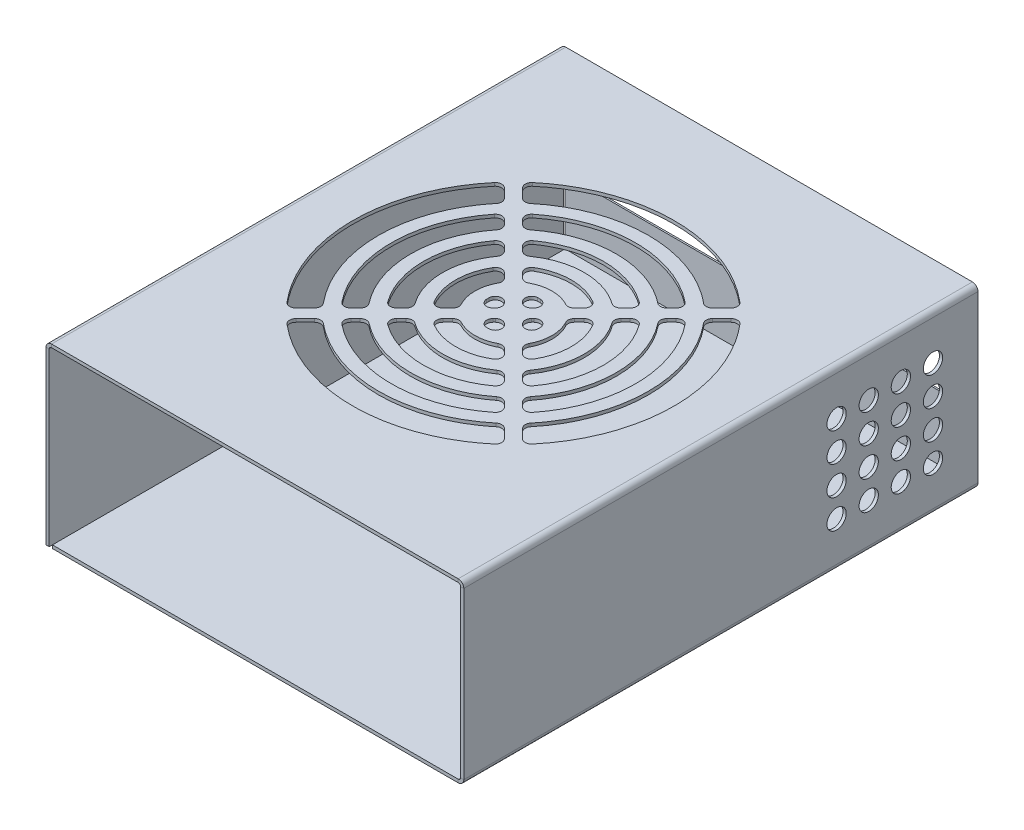
from build123d import *

# Parameters (mm, degrees)
BASE_FLANGE2_DEPTH  = 160
VENT1_START         = 54
VENT1_DEPTH         = 1
SKETCH25_W          = 126.2634
SKETCH25_H          = 0.5
BOSS_EXTRUDE3_DEPTH = 20
SKETCH27_W          = 126.5268
SKETCH27_H          = 2
BOSS_EXTRUDE4_DEPTH = 20
SKETCH28_R          = 3
CUT_EXTRUDE1_DEPTH  = 10


# Read off the part's stored shape, not the designer's step: Vent1
# Sheet-metal steps are written as plain solids
with BuildPart() as part:
    # Sketch1 → Base-Flange2 (new body)
    with BuildSketch(Plane.XY):
        with BuildLine():
            Line((0, 0), (0, 53.2634))
            ThreePointArc((0, 53.2634), (0.508638364, 54.491361636), (1.7366, 55))
            Line((1.7366, 55), (128.2634, 55))
            ThreePointArc((128.2634, 55), (129.491361636, 54.491361636), (130, 53.2634))
            Line((130, 53.2634), (130, 1.7366))
            ThreePointArc((130, 1.7366), (129.491361636, 0.508638364), (128.2634, 0))
            Line((128.2634, 0), (2, 0))
            Line((2, 0), (2, 1))
            Line((2, 1), (128.2634, 1))
            ThreePointArc((128.2634, 1), (128.784254855, 1.215745145), (129, 1.7366))
            Line((129, 1.7366), (129, 53.2634))
            ThreePointArc((129, 53.2634), (128.784254855, 53.784254855), (128.2634, 54))
            Line((128.2634, 54), (1.7366, 54))
            ThreePointArc((1.7366, 54), (1.215745145, 53.784254855), (1, 53.2634))
            Line((1, 53.2634), (1, 0))
            Line((1, 0), (0, 0))
        make_face()
    extrude(amount=BASE_FLANGE2_DEPTH)

    # Vent1 outline → Vent1 (cut)
    with BuildSketch(Plane(origin=(0, 0, 0), x_dir=(1, 0, 0), z_dir=(0, 1, 0)).offset(VENT1_START)):
        with BuildLine():
            ThreePointArc((30.082139275, -47.449789294), (28.584622626, -46.865738461), (27.14091293, -47.572402315))
            add(Edge.make_bspline(
                [(27.14091293, -47.572402315), (26.982214266, -47.760026027), (25.777430122, -49.205996623), (23.680073283, -52.036028488), (21.151872309, -56.250671963), (19.052170644, -60.694148895), (17.394784493, -65.321036718), (16.202307354, -70.088764961), (15.479428448, -74.95008843), (15.240002061, -79.858846861), (15.479410231, -84.76778804), (16.202235618, -89.628935826), (17.394730542, -94.39684686), (19.052029931, -99.023572814), (21.15178469, -103.467225566), (23.679869024, -107.68172717), (25.777318904, -110.511917442), (26.98209546, -111.957894833), (27.140913183, -112.145659251)],
                knots=[0.388277454, 0.388277454, 0.388277454, 0.388277454, 0.390624117, 0.406249996, 0.421874117, 0.437499996, 0.453124117, 0.468749996, 0.484374117, 0.499999996, 0.515624117, 0.531249996, 0.546874117, 0.562499996, 0.578124117, 0.593749996, 0.609374117, 0.61172254, 0.61172254, 0.61172254, 0.61172254], degree=3))
            ThreePointArc((27.140913183, -112.145659251), (28.584622839, -112.852322899), (30.082139349, -112.26827206))
            Line((30.082139349, -112.26827206), (32.921385852, -109.429025558))
            ThreePointArc((32.921385852, -109.429025558), (33.505103142, -108.105764237), (33.044029266, -106.734940661))
            add(Edge.make_bspline(
                [(33.044029345, -52.983120633), (32.980126693, -53.059854323), (32.040691116, -54.196190961), (30.342437867, -56.487698284), (28.218745017, -60.028003701), (26.454997453, -63.760518251), (25.06279009, -67.647109614), (24.061109906, -71.651995023), (23.453889777, -75.735512806), (23.252770982, -79.858863575), (23.453873217, -83.982380479), (24.061044692, -88.065738549), (25.062741044, -92.070790132), (26.45486953, -95.957234344), (28.218665371, -99.68990872), (30.342252152, -103.230085202), (32.040590542, -105.521735994), (32.980019469, -106.658078322), (33.044029266, -106.734940661)],
                knots=[0.389488825, 0.389488825, 0.389488825, 0.389488825, 0.390624044, 0.406249995, 0.421874044, 0.437499995, 0.453124044, 0.468749995, 0.484374044, 0.499999995, 0.515624044, 0.531249995, 0.546874044, 0.562499995, 0.578124044, 0.593749995, 0.609374044, 0.610511167, 0.610511167, 0.610511167, 0.610511167], degree=3))
            ThreePointArc((33.044029345, -52.983120633), (33.50510312, -51.612297097), (32.921385833, -50.289035852))
            Line((32.921385833, -50.289035852), (30.082139275, -47.449789294))
        make_face()
        with BuildLine():
            ThreePointArc((97.729049259, -44.621362151), (98.313100091, -43.123845478), (97.606436201, -41.680135774))
            add(Edge.make_bspline(
                [(97.606436201, -41.680135774), (97.418812497, -41.521437124), (95.972841881, -40.31665305), (93.142806383, -38.219294172), (88.928163855, -35.691091323), (84.484677899, -33.591389071), (79.857793802, -31.934004798), (75.090057161, -30.741527024), (70.228741703, -30.018650504), (65.319974957, -29.779224955), (60.411042092, -30.018633962), (55.549886297, -30.741461737), (50.78198366, -31.933956025), (46.155253979, -33.591257291), (41.711610261, -35.69101147), (37.497107673, -38.219093898), (34.666921169, -40.316541796), (33.220943742, -41.521318312), (33.03317934, -41.680136006)],
                knots=[0.138277454, 0.138277454, 0.138277454, 0.138277454, 0.140624117, 0.156249996, 0.171874157, 0.187499996, 0.203124197, 0.218749996, 0.234374197, 0.249999996, 0.265624197, 0.281249996, 0.296874197, 0.312499996, 0.328124157, 0.343749996, 0.359374117, 0.361722539, 0.361722539, 0.361722539, 0.361722539], degree=3))
            ThreePointArc((33.03317934, -41.680136006), (32.326515624, -43.123845675), (32.910566462, -44.621362231))
            Line((32.910566462, -44.621362231), (35.749812977, -47.460608746))
            ThreePointArc((35.749812977, -47.460608746), (37.073074297, -48.044326036), (38.443897874, -47.583252161))
            add(Edge.make_bspline(
                [(92.195717914, -47.583252246), (92.118990654, -47.519354951), (90.982654296, -46.579919046), (88.691154135, -44.881670086), (85.150842331, -42.757971749), (81.418331743, -40.994225489), (77.531733583, -39.602012163), (73.526847518, -38.60033397), (69.44332577, -37.993112524), (65.319974948, -37.791993916), (61.196458059, -37.9930961), (57.113099984, -38.600267589), (53.108048402, -39.601963937), (49.22160419, -40.994092425), (45.488929814, -42.757888265), (41.948753333, -44.881475046), (39.65710254, -46.579813436), (38.520760212, -47.519242363), (38.443897874, -47.583252161)],
                knots=[0.139488825, 0.139488825, 0.139488825, 0.139488825, 0.140623949, 0.156249995, 0.171873949, 0.187499995, 0.203123996, 0.218749995, 0.234374044, 0.249999995, 0.265624044, 0.281249995, 0.296874044, 0.312499995, 0.328124044, 0.343749995, 0.359374044, 0.360511167, 0.360511167, 0.360511167, 0.360511167], degree=3))
            ThreePointArc((92.195717914, -47.583252246), (93.566541446, -48.044326012), (94.889802684, -47.460608726))
            Line((94.889802684, -47.460608726), (97.729049259, -44.621362151))
        make_face()
        with BuildLine():
            ThreePointArc((32.910565565, -115.096700094), (32.326514725, -116.594216583), (33.033178341, -118.037926232))
            add(Edge.make_bspline(
                [(33.033178341, -118.037926232), (33.220805336, -118.196627724), (34.666776082, -119.401411914), (37.496816239, -121.498771922), (41.711456423, -124.026970329), (46.154941469, -126.126674253), (50.781821901, -127.784056503), (55.549558462, -128.976534439), (60.410873942, -129.699410916), (65.319640681, -129.938836473), (70.228573553, -129.699427476), (75.089729324, -128.976599655), (79.85763205, -127.78410554), (84.484365364, -126.126802209), (88.928010114, -124.027049855), (93.142518204, -121.498960251), (95.972701137, -119.401514543), (97.418678277, -118.196737754), (97.606436275, -118.037925486)],
                knots=[0.638277453, 0.638277453, 0.638277453, 0.638277453, 0.640624157, 0.656249996, 0.671874197, 0.687499996, 0.703124197, 0.718749996, 0.734374197, 0.749999996, 0.765624197, 0.781249996, 0.796874197, 0.812499996, 0.828124197, 0.843749996, 0.859374197, 0.861722539, 0.861722539, 0.861722539, 0.861722539], degree=3))
            ThreePointArc((97.606436275, -118.037925486), (98.313100037, -116.594215807), (97.729049201, -115.09669922))
            Line((97.729049201, -115.09669922), (94.889802663, -112.257452682))
            ThreePointArc((94.889802663, -112.257452682), (93.566541342, -111.673735393), (92.195717766, -112.134809268))
            add(Edge.make_bspline(
                [(38.443897739, -112.13480919), (38.520631429, -112.198711841), (39.656968067, -113.138147418), (41.94847539, -114.836400667), (45.488780807, -116.960093517), (49.221295357, -118.723841081), (53.107886719, -120.116048444), (57.112772129, -121.117728628), (61.196289912, -121.724948757), (65.319640681, -121.926067552), (69.443157584, -121.724965318), (73.526515655, -121.117793843), (77.531567238, -120.11609749), (81.41801145, -118.723969004), (85.150685826, -116.960173163), (88.690862307, -114.836586383), (90.9825131, -113.138247993), (92.118855428, -112.198819065), (92.195717766, -112.134809268)],
                knots=[0.639488825, 0.639488825, 0.639488825, 0.639488825, 0.640624044, 0.656249995, 0.671874044, 0.687499995, 0.703124044, 0.718749995, 0.734374044, 0.749999995, 0.765624044, 0.781249995, 0.796874044, 0.812499995, 0.828124044, 0.843749995, 0.859374044, 0.860511167, 0.860511167, 0.860511167, 0.860511167], degree=3))
            ThreePointArc((38.443897739, -112.13480919), (37.073074203, -111.673735415), (35.749812958, -112.257452701))
            Line((35.749812958, -112.257452701), (32.910565565, -115.096700094))
        make_face()
        with BuildLine():
            ThreePointArc((100.557476362, -112.268272131), (102.054993004, -112.852322965), (103.498702699, -112.145659121))
            add(Edge.make_bspline(
                [(103.498702699, -112.145659121), (103.657406774, -111.958029013), (104.862190572, -110.51205811), (106.959551614, -107.682019037), (109.487747415, -103.467382029), (111.587451016, -99.02389704), (113.244835002, -94.397016815), (114.437316529, -89.629238538), (115.160211781, -84.767924785), (115.319814733, -81.495355993), (115.31980782, -79.859030714), (115.319800908, -78.222793716), (115.160178958, -74.95022958), (114.437374627, -70.089079925), (113.244883533, -65.321214774), (111.58758613, -60.694488557), (109.487830831, -56.250835885), (106.959746671, -52.036334226), (104.862296706, -49.206144092), (103.657520257, -47.760166646), (103.498702575, -47.572402251)],
                knots=[0.888277454, 0.888277454, 0.888277454, 0.888277454, 0.890624197, 0.906249996, 0.921874197, 0.937499996, 0.953124197, 0.968749996, 0.984374599, 1, 1, 1, 1.015624558, 1.031249996, 1.046874117, 1.062499996, 1.078124117, 1.093749996, 1.109374117, 1.111722539, 1.111722539, 1.111722539, 1.111722539], degree=3))
            ThreePointArc((103.498702575, -47.572402251), (102.054992899, -46.865738502), (100.557476321, -47.449789338))
            Line((100.557476321, -47.449789338), (97.718229786, -50.289035873))
            ThreePointArc((97.718229786, -50.289035873), (97.134512496, -51.612297199), (97.59558638, -52.983120779))
            add(Edge.make_bspline(
                [(97.595586294, -106.734940799), (97.659488946, -106.658207108), (98.59892452, -105.521870468), (100.297177746, -103.230363141), (102.420870723, -99.690057741), (104.184617811, -95.957543127), (105.576826952, -92.070952004), (106.578510716, -88.066024868), (107.185749624, -83.982508816), (107.319814733, -81.233550669), (107.31980782, -79.859030714), (107.319800908, -78.48459904), (107.185716801, -75.735645549), (106.578568815, -71.652293594), (105.576875483, -67.647279586), (104.184752925, -63.760842471), (102.420954138, -60.028160174), (100.297372804, -56.48799012), (98.599030132, -54.196332159), (97.659601534, -53.059989549), (97.59558638, -52.983120779)],
                knots=[0.889488825, 0.889488825, 0.889488825, 0.889488825, 0.890624044, 0.906249995, 0.921874044, 0.937499995, 0.953124044, 0.968749995, 0.984374522, 1, 1, 1, 1.015624474, 1.031249995, 1.046873949, 1.062499995, 1.078123949, 1.093749995, 1.109373949, 1.110511166, 1.110511166, 1.110511166, 1.110511166], degree=3))
            ThreePointArc((97.595586294, -106.734940799), (97.134512521, -108.105764334), (97.718229807, -109.429025577))
            Line((97.718229807, -109.429025577), (100.557476362, -112.268272131))
        make_face()
        with BuildLine():
            ThreePointArc((41.435501176, -106.571764483), (40.852818334, -108.097354655), (41.601538547, -109.548686013))
            add(Edge.make_bspline(
                [(41.601538547, -109.548686013), (42.442832812, -110.220649998), (44.317606842, -111.591175423), (47.377442856, -113.426655291), (50.754472339, -115.022424446), (54.270919119, -116.282044428), (57.894378965, -117.188325719), (61.588997896, -117.737717678), (65.319640681, -117.919683092), (69.0504496, -117.737734238), (72.744908821, -117.188390936), (76.368534832, -116.282093465), (79.884834493, -115.022552402), (83.262023682, -113.426734817), (86.321874421, -111.591274358), (88.196782443, -110.220649195), (89.038076682, -109.548684875)],
                knots=[0.642721101, 0.642721101, 0.642721101, 0.642721101, 0.656249995, 0.671873944, 0.687499995, 0.703123944, 0.718749995, 0.734373944, 0.749999995, 0.765623944, 0.781249995, 0.796873944, 0.812499995, 0.828123944, 0.843749995, 0.857278892, 0.857278892, 0.857278892, 0.857278892], degree=3))
            ThreePointArc((89.038076682, -109.548684875), (89.786796505, -108.097353582), (89.204113649, -106.571763668))
            Line((89.204113649, -106.571763668), (87.780185051, -105.14783507))
            ThreePointArc((87.780185051, -105.14783507), (86.483794791, -104.565522232), (85.12791213, -104.991313447))
            add(Edge.make_bspline(
                [(45.511703469, -104.991313414), (46.168710622, -105.509168886), (48.541629868, -107.233376712), (52.994998734, -109.613751963), (59.036674635, -111.446474311), (65.31980782, -112.065308916), (71.602941005, -111.446474311), (77.644616906, -109.613751963), (82.097985772, -107.233376712), (84.470905018, -105.509168886), (85.12791213, -104.991313447)],
                knots=[0.643767906, 0.643767906, 0.643767906, 0.643767906, 0.65625, 0.6875, 0.71875, 0.75, 0.78125, 0.8125, 0.84375, 0.856232094, 0.856232094, 0.856232094, 0.856232094], degree=3))
            ThreePointArc((45.511703469, -104.991313414), (44.155820852, -104.565522232), (42.859430589, -105.14783507))
            Line((42.859430589, -105.14783507), (41.435501176, -106.571764483))
        make_face()
        with BuildLine():
            ThreePointArc((38.6070749, -55.974724919), (37.081484906, -55.392042067), (35.630153592, -56.140762011))
            add(Edge.make_bspline(
                [(35.630153592, -56.140762011), (34.958189407, -56.982056221), (33.587667651, -58.856822604), (31.752187347, -61.916658395), (30.156420451, -65.293679766), (28.896796568, -68.810133936), (27.990516073, -72.433585465), (27.441121686, -76.128212383), (27.259155442, -79.858846861), (27.441103469, -83.589664087), (27.990444337, -87.284115322), (28.896742617, -90.907749643), (30.156279738, -94.424041944), (31.752099729, -97.801239133), (33.587559288, -100.861090571), (34.958189322, -102.736005442), (35.630153696, -103.577299669)],
                knots=[0.392721099, 0.392721099, 0.392721099, 0.392721099, 0.406249994, 0.421873838, 0.437499994, 0.453123838, 0.468749994, 0.484373838, 0.499999994, 0.515623838, 0.531249994, 0.546873838, 0.562499994, 0.578123838, 0.593749994, 0.607278892, 0.607278892, 0.607278892, 0.607278892], degree=3))
            ThreePointArc((35.630153696, -103.577299669), (37.081484978, -104.326019423), (38.607074846, -103.743336564))
            Line((38.607074846, -103.743336564), (40.031003464, -102.319407946))
            ThreePointArc((40.031003464, -102.319407946), (40.613316303, -101.023017685), (40.187525087, -99.667135024))
            add(Edge.make_bspline(
                [(40.18752512, -60.050926363), (39.669669648, -60.707933516), (37.945461823, -63.080852762), (35.565086571, -67.534221628), (33.732364223, -73.575897529), (33.113529618, -79.859030714), (33.732364223, -86.1421639), (35.565086571, -92.1838398), (37.945461823, -96.637208666), (39.669669648, -99.010127912), (40.187525087, -99.667135024)],
                knots=[0.393767906, 0.393767906, 0.393767906, 0.393767906, 0.40625, 0.4375, 0.46875, 0.5, 0.53125, 0.5625, 0.59375, 0.606232094, 0.606232094, 0.606232094, 0.606232094], degree=3))
            ThreePointArc((40.18752512, -60.050926363), (40.613316303, -58.695043746), (40.031003464, -57.398653483))
            Line((40.031003464, -57.398653483), (38.6070749, -55.974724919))
        make_face()
        with BuildLine():
            ThreePointArc((89.204113615, -53.146297795), (89.786796467, -51.6207078), (89.038076523, -50.169376486))
            add(Edge.make_bspline(
                [(89.038076523, -50.169376486), (88.196782313, -49.497412301), (86.32201593, -48.126890545), (83.262180139, -46.291410241), (79.885158769, -44.695643346), (76.368704599, -43.436019462), (72.745253069, -42.529738967), (69.050626151, -41.98034458), (65.319991673, -41.798378336), (61.589174448, -41.980326363), (57.894723212, -42.529667231), (54.271088892, -43.435965512), (50.754796588, -44.69550263), (47.377599409, -46.29132263), (44.317747958, -48.126782142), (42.442833191, -49.497412231), (41.60153895, -50.169376557)],
                knots=[0.142721099, 0.142721099, 0.142721099, 0.142721099, 0.156249994, 0.171873838, 0.187499994, 0.203123838, 0.218749994, 0.234373838, 0.249999994, 0.265623838, 0.281249994, 0.296873838, 0.312499994, 0.328123838, 0.343749994, 0.357278892, 0.357278892, 0.357278892, 0.357278892], degree=3))
            ThreePointArc((41.60153895, -50.169376557), (40.852819133, -51.620707849), (41.43550199, -53.14629776))
            Line((41.43550199, -53.14629776), (42.859430589, -54.570226358))
            ThreePointArc((42.859430589, -54.570226358), (44.155820849, -55.152539197), (45.51170351, -54.726747981))
            add(Edge.make_bspline(
                [(85.127912172, -54.726748014), (84.470905018, -54.208892542), (82.097985772, -52.484684717), (77.644616906, -50.104309465), (71.602941005, -48.271587118), (65.31980782, -47.652752513), (59.036674635, -48.271587118), (52.994998734, -50.104309465), (48.541629868, -52.484684717), (46.168710622, -54.208892542), (45.51170351, -54.726747981)],
                knots=[0.143767906, 0.143767906, 0.143767906, 0.143767906, 0.15625, 0.1875, 0.21875, 0.25, 0.28125, 0.3125, 0.34375, 0.356232094, 0.356232094, 0.356232094, 0.356232094], degree=3))
            ThreePointArc((85.127912172, -54.726748014), (86.483794788, -55.152539197), (87.780185051, -54.570226358))
            Line((87.780185051, -54.570226358), (89.204113615, -53.146297795))
        make_face()
        with BuildLine():
            ThreePointArc((92.03254074, -103.74333651), (93.558130735, -104.326019362), (95.009462049, -103.577299418))
            add(Edge.make_bspline(
                [(95.009462049, -103.577299418), (95.681426234, -102.736005208), (97.051952896, -100.86123208), (98.887432377, -97.801395597), (100.483201209, -94.42436617), (101.742822927, -90.907919598), (102.649107809, -87.284418034), (103.198518545, -83.589800831), (103.319814733, -81.102648007), (103.31980782, -79.859030714), (103.319800908, -78.615501702), (103.198485722, -76.128353534), (102.649165908, -72.433900429), (101.742871458, -68.810311992), (100.483336323, -65.294019427), (98.887515792, -61.916822318), (97.052056414, -58.856970846), (95.681426307, -56.982056079), (95.009461973, -56.140761836)],
                knots=[0.8927211, 0.8927211, 0.8927211, 0.8927211, 0.906249995, 0.921873944, 0.937499995, 0.953123944, 0.968749995, 0.984374472, 1, 1, 1, 1.015624419, 1.031249994, 1.046873838, 1.062499994, 1.078123838, 1.093749994, 1.107278892, 1.107278892, 1.107278892, 1.107278892], degree=3))
            ThreePointArc((95.009461973, -56.140761836), (93.558130682, -55.392042026), (92.032540776, -55.974724883))
            Line((92.032540776, -55.974724883), (90.608612176, -57.398653483))
            ThreePointArc((90.608612176, -57.398653483), (90.026299338, -58.695043744), (90.452090553, -60.050926405))
            add(Edge.make_bspline(
                [(90.45209052, -99.667135066), (90.969945992, -99.010127912), (92.694153818, -96.637208666), (95.074529069, -92.1838398), (96.907251417, -86.1421639), (97.31980782, -81.953408443), (97.31980782, -79.859030714), (97.31980782, -77.764652986), (96.907251417, -73.575897529), (95.074529069, -67.534221628), (92.694153818, -63.080852762), (90.969945992, -60.707933516), (90.452090553, -60.050926405)],
                knots=[0.893767906, 0.893767906, 0.893767906, 0.893767906, 0.90625, 0.9375, 0.96875, 1, 1, 1, 1.03125, 1.0625, 1.09375, 1.106232094, 1.106232094, 1.106232094, 1.106232094], degree=3))
            ThreePointArc((90.45209052, -99.667135066), (90.026299337, -101.023017682), (90.608612176, -102.319407946))
            Line((90.608612176, -102.319407946), (92.03254074, -103.74333651))
        make_face()
        with BuildLine():
            ThreePointArc((48.568154514, -99.439111145), (47.988324487, -101.007565299), (48.802456202, -102.468195589))
            add(Edge.make_bspline(
                [(48.802456202, -102.468195589), (49.118175611, -102.69887724), (50.94106508, -103.973092933), (54.53559987, -105.894411807), (59.822066283, -107.498043861), (65.31980782, -108.039524141), (70.817549357, -107.498043861), (76.10401577, -105.894411807), (79.69855056, -103.973092933), (81.521440029, -102.69887724), (81.837159439, -102.468195589)],
                knots=[0.649582268, 0.649582268, 0.649582268, 0.649582268, 0.65625, 0.6875, 0.71875, 0.75, 0.78125, 0.8125, 0.84375, 0.850417732, 0.850417732, 0.850417732, 0.850417732], degree=3))
            ThreePointArc((81.837159439, -102.468195589), (82.651291154, -101.007565299), (82.071461126, -99.439111145))
            Line((82.071461126, -99.439111145), (80.63877927, -98.006429289))
            ThreePointArc((80.63877927, -98.006429289), (79.39176688, -97.427644164), (78.065750594, -97.790566923))
            add(Edge.make_bspline(
                [(52.573865028, -97.79056691), (52.746578754, -97.913348473), (54.106692458, -98.85094309), (56.846501573, -100.315401573), (61.000153755, -101.575398187), (65.31980782, -102.000846978), (69.639461885, -101.575398187), (73.793114067, -100.315401573), (76.532923182, -98.85094309), (77.893036887, -97.913348473), (78.065750594, -97.790566923)],
                knots=[0.65165093, 0.65165093, 0.65165093, 0.65165093, 0.65625, 0.6875, 0.71875, 0.75, 0.78125, 0.8125, 0.84375, 0.84834907, 0.84834907, 0.84834907, 0.84834907], degree=3))
            ThreePointArc((52.573865028, -97.79056691), (51.247848757, -97.427644164), (50.00083637, -98.006429289))
            Line((50.00083637, -98.006429289), (48.568154514, -99.439111145))
        make_face()
        with BuildLine():
            ThreePointArc((45.73972739, -63.107377409), (44.171273236, -62.527547381), (42.710642945, -63.341679096))
            add(Edge.make_bspline(
                [(42.710642945, -63.341679096), (42.479961294, -63.657398505), (41.205745601, -65.480287974), (39.284426727, -69.074822764), (37.680794673, -74.361289177), (37.139314394, -79.859030714), (37.680794673, -85.356772251), (39.284426727, -90.643238664), (41.205745601, -94.237773454), (42.479961294, -96.060662923), (42.710642945, -96.376382333)],
                knots=[0.399582268, 0.399582268, 0.399582268, 0.399582268, 0.40625, 0.4375, 0.46875, 0.5, 0.53125, 0.5625, 0.59375, 0.600417732, 0.600417732, 0.600417732, 0.600417732], degree=3))
            ThreePointArc((42.710642945, -96.376382333), (44.171273236, -97.190514048), (45.73972739, -96.61068402))
            Line((45.73972739, -96.61068402), (47.172409245, -95.178002164))
            ThreePointArc((47.172409245, -95.178002164), (47.75119437, -93.930989774), (47.388271611, -92.604973488))
            add(Edge.make_bspline(
                [(47.388271624, -67.113087922), (47.265490061, -67.285801648), (46.327895444, -68.645915353), (44.863436961, -71.385724468), (43.603440347, -75.539376649), (43.177991556, -79.859030714), (43.603440347, -84.178684779), (44.863436961, -88.332336961), (46.327895444, -91.072146076), (47.265490061, -92.432259781), (47.388271611, -92.604973488)],
                knots=[0.40165093, 0.40165093, 0.40165093, 0.40165093, 0.40625, 0.4375, 0.46875, 0.5, 0.53125, 0.5625, 0.59375, 0.59834907, 0.59834907, 0.59834907, 0.59834907], degree=3))
            ThreePointArc((47.388271624, -67.113087922), (47.75119437, -65.787071651), (47.172409245, -64.540059264))
            Line((47.172409245, -64.540059264), (45.73972739, -63.107377409))
        make_face()
        with BuildLine():
            ThreePointArc((82.071461126, -60.278950284), (82.651291154, -58.710496129), (81.837159438, -57.249865839))
            add(Edge.make_bspline(
                [(81.837159438, -57.249865839), (81.521440029, -57.019184188), (79.69855056, -55.744968495), (76.10401577, -53.823649622), (70.817549357, -52.220017567), (65.31980782, -51.678537288), (59.822066283, -52.220017567), (54.53559987, -53.823649622), (50.94106508, -55.744968495), (49.118175611, -57.019184188), (48.802456201, -57.249865839)],
                knots=[0.149582268, 0.149582268, 0.149582268, 0.149582268, 0.15625, 0.1875, 0.21875, 0.25, 0.28125, 0.3125, 0.34375, 0.350417732, 0.350417732, 0.350417732, 0.350417732], degree=3))
            ThreePointArc((48.802456201, -57.249865839), (47.988324487, -58.71049613), (48.568154514, -60.278950284))
            Line((48.568154514, -60.278950284), (50.00083637, -61.711632139))
            ThreePointArc((50.00083637, -61.711632139), (51.24784876, -62.290417264), (52.573865046, -61.927494505))
            add(Edge.make_bspline(
                [(78.065750612, -61.927494518), (77.893036887, -61.804712955), (76.532923182, -60.867118338), (73.793114067, -59.402659856), (69.639461885, -58.142663242), (65.31980782, -57.717214451), (61.000153755, -58.142663242), (56.846501573, -59.402659856), (54.106692458, -60.867118338), (52.746578754, -61.804712955), (52.573865046, -61.927494505)],
                knots=[0.15165093, 0.15165093, 0.15165093, 0.15165093, 0.15625, 0.1875, 0.21875, 0.25, 0.28125, 0.3125, 0.34375, 0.34834907, 0.34834907, 0.34834907, 0.34834907], degree=3))
            ThreePointArc((78.065750612, -61.927494518), (79.391766883, -62.290417264), (80.63877927, -61.711632139))
            Line((80.63877927, -61.711632139), (82.071461126, -60.278950284))
        make_face()
        with BuildLine():
            ThreePointArc((84.89988825, -96.61068402), (86.468342404, -97.190514048), (87.928972695, -96.376382333))
            add(Edge.make_bspline(
                [(87.928972695, -96.376382333), (88.159654346, -96.060662923), (89.433870039, -94.237773454), (91.355188913, -90.643238664), (92.958820967, -85.356772251), (93.31980782, -81.691611227), (93.31980782, -79.859030714), (93.31980782, -78.026450202), (92.958820967, -74.361289177), (91.355188913, -69.074822764), (89.433870039, -65.480287974), (88.159654346, -63.657398505), (87.928972695, -63.341679095)],
                knots=[0.899582268, 0.899582268, 0.899582268, 0.899582268, 0.90625, 0.9375, 0.96875, 1, 1, 1, 1.03125, 1.0625, 1.09375, 1.100417732, 1.100417732, 1.100417732, 1.100417732], degree=3))
            ThreePointArc((87.928972695, -63.341679095), (86.468342404, -62.527547381), (84.89988825, -63.107377409))
            Line((84.89988825, -63.107377409), (83.467206395, -64.540059264))
            ThreePointArc((83.467206395, -64.540059264), (82.88842127, -65.787071654), (83.251344029, -67.11308794))
            add(Edge.make_bspline(
                [(83.251344016, -92.604973506), (83.374125579, -92.432259781), (84.311720196, -91.072146076), (85.776178679, -88.332336961), (87.036175293, -84.178684779), (87.31980782, -81.298915403), (87.31980782, -79.859030714), (87.31980782, -78.419146026), (87.036175293, -75.539376649), (85.776178679, -71.385724468), (84.311720196, -68.645915353), (83.374125579, -67.285801648), (83.251344029, -67.11308794)],
                knots=[0.90165093, 0.90165093, 0.90165093, 0.90165093, 0.90625, 0.9375, 0.96875, 1, 1, 1, 1.03125, 1.0625, 1.09375, 1.09834907, 1.09834907, 1.09834907, 1.09834907], degree=3))
            ThreePointArc((83.251344016, -92.604973506), (82.88842127, -93.930989777), (83.467206395, -95.178002164))
            Line((83.467206395, -95.178002164), (84.89988825, -96.61068402))
        make_face()
        with BuildLine():
            ThreePointArc((55.779604619, -92.22766104), (55.209766763, -93.893945962), (56.178174202, -95.364798659))
            add(Edge.make_bspline(
                [(56.178174202, -95.364798659), (56.901858216, -95.791402092), (58.712141523, -96.694660863), (61.785545403, -97.626967737), (65.31980782, -97.975062203), (68.854070237, -97.626967737), (71.927474116, -96.694660863), (73.737757423, -95.791402092), (74.461441473, -95.364798639)],
                knots=[0.665216574, 0.665216574, 0.665216574, 0.665216574, 0.6875, 0.71875, 0.75, 0.78125, 0.8125, 0.834783426, 0.834783426, 0.834783426, 0.834783426], degree=3))
            ThreePointArc((74.461441473, -95.364798639), (75.429848877, -93.893945962), (74.860011021, -92.22766104))
            Line((74.860011021, -92.22766104), (73.392392798, -90.760042817))
            ThreePointArc((73.392392798, -90.760042817), (72.266925944, -90.195209806), (71.026991812, -90.414926255))
            add(Edge.make_bspline(
                [(59.612623827, -90.414926255), (59.974862146, -90.610771553), (61.05725221, -91.12602781), (62.963632876, -91.704322063), (65.31980782, -91.93638504), (67.675982765, -91.704322063), (69.582363433, -91.12602781), (70.664753499, -90.610771551), (71.026991812, -90.414926255)],
                knots=[0.671115403, 0.671115403, 0.671115403, 0.671115403, 0.6875, 0.71875, 0.75, 0.78125, 0.8125, 0.828884597, 0.828884597, 0.828884597, 0.828884597], degree=3))
            ThreePointArc((59.612623827, -90.414926255), (58.372689696, -90.195209806), (57.247222842, -90.760042817))
            Line((57.247222842, -90.760042817), (55.779604619, -92.22766104))
        make_face()
        with BuildLine():
            ThreePointArc((52.951177494, -70.318827513), (51.284892572, -69.748989658), (49.814039875, -70.717397096))
            add(Edge.make_bspline(
                [(49.814039875, -70.717397096), (49.387436443, -71.44108111), (48.484177671, -73.251364417), (47.551870797, -76.324768298), (47.203776332, -79.859030714), (47.551870797, -83.393293131), (48.484177671, -86.466697011), (49.387436442, -88.276980317), (49.814039895, -89.000664367)],
                knots=[0.415216574, 0.415216574, 0.415216574, 0.415216574, 0.4375, 0.46875, 0.5, 0.53125, 0.5625, 0.584783426, 0.584783426, 0.584783426, 0.584783426], degree=3))
            ThreePointArc((49.814039895, -89.000664367), (51.284892572, -89.969071771), (52.951177494, -89.399233915))
            Line((52.951177494, -89.399233915), (54.418795718, -87.931615692))
            ThreePointArc((54.418795718, -87.931615692), (54.983628728, -86.806148838), (54.763912279, -85.566214706))
            add(Edge.make_bspline(
                [(54.76391228, -74.151846721), (54.568066981, -74.51408504), (54.052810724, -75.596475104), (53.474516471, -77.50285577), (53.242453494, -79.859030714), (53.474516471, -82.215205659), (54.052810725, -84.121586327), (54.568066984, -85.203976393), (54.763912279, -85.566214706)],
                knots=[0.421115403, 0.421115403, 0.421115403, 0.421115403, 0.4375, 0.46875, 0.5, 0.53125, 0.5625, 0.578884597, 0.578884597, 0.578884597, 0.578884597], degree=3))
            ThreePointArc((54.76391228, -74.151846721), (54.983628728, -72.911912591), (54.418795718, -71.786445736))
            Line((54.418795718, -71.786445736), (52.951177494, -70.318827513))
        make_face()
        with BuildLine():
            ThreePointArc((74.860011021, -67.490400389), (75.429848877, -65.824115466), (74.461441438, -64.353262769))
            add(Edge.make_bspline(
                [(74.461441438, -64.353262769), (73.737757424, -63.926659337), (71.927474117, -63.023400565), (68.854070237, -62.091093691), (65.31980782, -61.742999226), (61.785545403, -62.091093691), (58.712141524, -63.023400565), (56.901858217, -63.926659336), (56.178174167, -64.35326279)],
                knots=[0.165216574, 0.165216574, 0.165216574, 0.165216574, 0.1875, 0.21875, 0.25, 0.28125, 0.3125, 0.334783426, 0.334783426, 0.334783426, 0.334783426], degree=3))
            ThreePointArc((56.178174167, -64.35326279), (55.209766763, -65.824115466), (55.779604619, -67.490400389))
            Line((55.779604619, -67.490400389), (57.247222842, -68.958018612))
            ThreePointArc((57.247222842, -68.958018612), (58.372689696, -69.522851622), (59.612623828, -69.303135173))
            add(Edge.make_bspline(
                [(71.026991813, -69.303135174), (70.664753494, -69.107289875), (69.58236343, -68.592033618), (67.675982765, -68.013739365), (65.31980782, -67.781676389), (62.963632876, -68.013739365), (61.057252207, -68.592033619), (59.974862141, -69.107289878), (59.612623828, -69.303135173)],
                knots=[0.171115403, 0.171115403, 0.171115403, 0.171115403, 0.1875, 0.21875, 0.25, 0.28125, 0.3125, 0.328884597, 0.328884597, 0.328884597, 0.328884597], degree=3))
            ThreePointArc((71.026991813, -69.303135174), (72.266925944, -69.522851622), (73.392392798, -68.958018612))
            Line((73.392392798, -68.958018612), (74.860011021, -67.490400389))
        make_face()
        with BuildLine():
            ThreePointArc((77.688438146, -89.399233915), (79.354723068, -89.969071771), (80.825575765, -89.000664332))
            add(Edge.make_bspline(
                [(80.825575765, -89.000664332), (81.252179197, -88.276980318), (82.155437969, -86.466697011), (83.087744843, -83.393293131), (83.31980782, -81.037118186), (83.31980782, -79.859030714), (83.31980782, -78.680943242), (83.087744843, -76.324768298), (82.155437969, -73.251364418), (81.252179198, -71.441081111), (80.825575745, -70.717397061)],
                knots=[0.915216574, 0.915216574, 0.915216574, 0.915216574, 0.9375, 0.96875, 1, 1, 1, 1.03125, 1.0625, 1.084783426, 1.084783426, 1.084783426, 1.084783426], degree=3))
            ThreePointArc((80.825575745, -70.717397061), (79.354723068, -69.748989658), (77.688438146, -70.318827513))
            Line((77.688438146, -70.318827513), (76.220819923, -71.786445736))
            ThreePointArc((76.220819923, -71.786445736), (75.655986912, -72.911912591), (75.875703361, -74.151846723))
            add(Edge.make_bspline(
                [(75.87570336, -85.566214707), (76.071548659, -85.203976388), (76.586804916, -84.121586324), (77.165099169, -82.215205659), (77.31980782, -80.644422362), (77.31980782, -79.859030714), (77.31980782, -79.073639066), (77.165099169, -77.50285577), (76.586804915, -75.596475102), (76.071548657, -74.514085035), (75.875703361, -74.151846723)],
                knots=[0.921115403, 0.921115403, 0.921115403, 0.921115403, 0.9375, 0.96875, 1, 1, 1, 1.03125, 1.0625, 1.078884597, 1.078884597, 1.078884597, 1.078884597], degree=3))
            ThreePointArc((75.87570336, -85.566214707), (75.655986912, -86.806148838), (76.220819923, -87.931615692))
            Line((76.220819923, -87.931615692), (77.688438146, -89.399233915))
        make_face()
        with BuildLine():
            ThreePointArc((63.571763297, -84.435502362), (63.117606579, -86.563293178), (64.874550287, -87.846609542))
            add(Edge.make_bspline(
                [(64.874550287, -87.846609542), (65.022816452, -87.854882789), (65.31980782, -87.86317864), (65.616799188, -87.854882789), (65.765065371, -87.846609541)],
                knots=[0.741137243, 0.741137243, 0.741137243, 0.741137243, 0.75, 0.758862757, 0.758862757, 0.758862757, 0.758862757], degree=3))
            ThreePointArc((65.765065371, -87.846609541), (67.522009061, -86.563293179), (67.067852343, -84.435502362))
            Line((67.067852343, -84.435502362), (66.734021382, -84.101671401))
            ThreePointArc((66.734021382, -84.101671401), (65.31980782, -83.515884964), (63.905594258, -84.101671401))
            Line((63.905594258, -84.101671401), (63.571763297, -84.435502362))
        make_face()
        with BuildLine():
            ThreePointArc((60.743336172, -78.110986191), (58.615545356, -77.656829473), (57.332228992, -79.413773181))
            add(Edge.make_bspline(
                [(57.332228992, -79.413773181), (57.323955746, -79.562039346), (57.315659894, -79.859030714), (57.323955746, -80.156022082), (57.332228993, -80.304288265)],
                knots=[0.491137243, 0.491137243, 0.491137243, 0.491137243, 0.5, 0.508862757, 0.508862757, 0.508862757, 0.508862757], degree=3))
            ThreePointArc((57.332228993, -80.304288265), (58.615545355, -82.061231955), (60.743336172, -81.607075238))
            Line((60.743336172, -81.607075238), (61.077167133, -81.273244277))
            ThreePointArc((61.077167133, -81.273244277), (61.662953571, -79.859030715), (61.077167133, -78.444817152))
            Line((61.077167133, -78.444817152), (60.743336172, -78.110986191))
        make_face()
        with BuildLine():
            ThreePointArc((67.067852343, -75.282559066), (67.522009061, -73.15476825), (65.765065353, -71.871451886))
            add(Edge.make_bspline(
                [(65.765065353, -71.871451886), (65.616799188, -71.86317864), (65.31980782, -71.854882789), (65.022816452, -71.86317864), (64.87455027, -71.871451887)],
                knots=[0.241137243, 0.241137243, 0.241137243, 0.241137243, 0.25, 0.258862757, 0.258862757, 0.258862757, 0.258862757], degree=3))
            ThreePointArc((64.87455027, -71.871451887), (63.117606579, -73.154768249), (63.571763297, -75.282559066))
            Line((63.571763297, -75.282559066), (63.905594258, -75.616390027))
            ThreePointArc((63.905594258, -75.616390027), (65.31980782, -76.202176465), (66.734021382, -75.616390027))
            Line((66.734021382, -75.616390027), (67.067852343, -75.282559066))
        make_face()
        with BuildLine():
            ThreePointArc((69.896279468, -81.607075238), (72.024070286, -82.061231954), (73.307386648, -80.304288243))
            add(Edge.make_bspline(
                [(73.307386648, -80.304288243), (73.315659894, -80.156022082), (73.31980782, -80.007526398), (73.31980782, -79.859030714), (73.31980782, -79.71053503), (73.315659894, -79.562039346), (73.307386647, -79.413773164)],
                knots=[0.991137243, 0.991137243, 0.991137243, 0.991137243, 1, 1, 1, 1.008862757, 1.008862757, 1.008862757, 1.008862757], degree=3))
            ThreePointArc((73.307386647, -79.413773164), (72.024070283, -77.656829473), (69.896279468, -78.110986191))
            Line((69.896279468, -78.110986191), (69.562448507, -78.444817152))
            ThreePointArc((69.562448507, -78.444817152), (68.97666207, -79.859030715), (69.562448507, -81.273244277))
            Line((69.562448507, -81.273244277), (69.896279468, -81.607075238))
        make_face()
    extrude(amount=VENT1_DEPTH, mode=Mode.SUBTRACT)

    # Sketch25 → Boss-Extrude3 (add)
    with BuildSketch(Plane(origin=(0, 1, 0), x_dir=(1, 0, 0), z_dir=(0, 1, 0))):
        with Locations((65.1317, -0.25)):
            Rectangle(SKETCH25_W, SKETCH25_H)
    extrude(amount=BOSS_EXTRUDE3_DEPTH)

    # Sketch27 → Boss-Extrude4 (add)
    with BuildSketch(Plane.XZ.offset(-54)):
        with Locations((65, 1)):
            Rectangle(SKETCH27_W, SKETCH27_H)
    extrude(amount=BOSS_EXTRUDE4_DEPTH)

    # Sketch28 → Cut-Extrude1 (cut)
    with BuildSketch(Plane(origin=(130, 0, 0), x_dir=(0, 0, -1), z_dir=(1, 0, 0))):
        with Locations((-14, 14)):
            Circle(SKETCH28_R)
        with Locations((-14, 23)):
            Circle(SKETCH28_R)
        with Locations((-14, 32)):
            Circle(SKETCH28_R)
        with Locations((-14, 41)):
            Circle(SKETCH28_R)
        with Locations((-24, 41)):
            Circle(SKETCH28_R)
        with Locations((-24, 32)):
            Circle(SKETCH28_R)
        with Locations((-24, 23)):
            Circle(SKETCH28_R)
        with Locations((-24, 14)):
            Circle(SKETCH28_R)
        with Locations((-34, 41)):
            Circle(SKETCH28_R)
        with Locations((-34, 32)):
            Circle(SKETCH28_R)
        with Locations((-34, 23)):
            Circle(SKETCH28_R)
        with Locations((-34, 14)):
            Circle(SKETCH28_R)
        with Locations((-44, 41)):
            Circle(SKETCH28_R)
        with Locations((-44, 32)):
            Circle(SKETCH28_R)
        with Locations((-44, 23)):
            Circle(SKETCH28_R)
        with Locations((-44, 14)):
            Circle(SKETCH28_R)
    extrude(amount=-CUT_EXTRUDE1_DEPTH, mode=Mode.SUBTRACT)


solid = part.part
